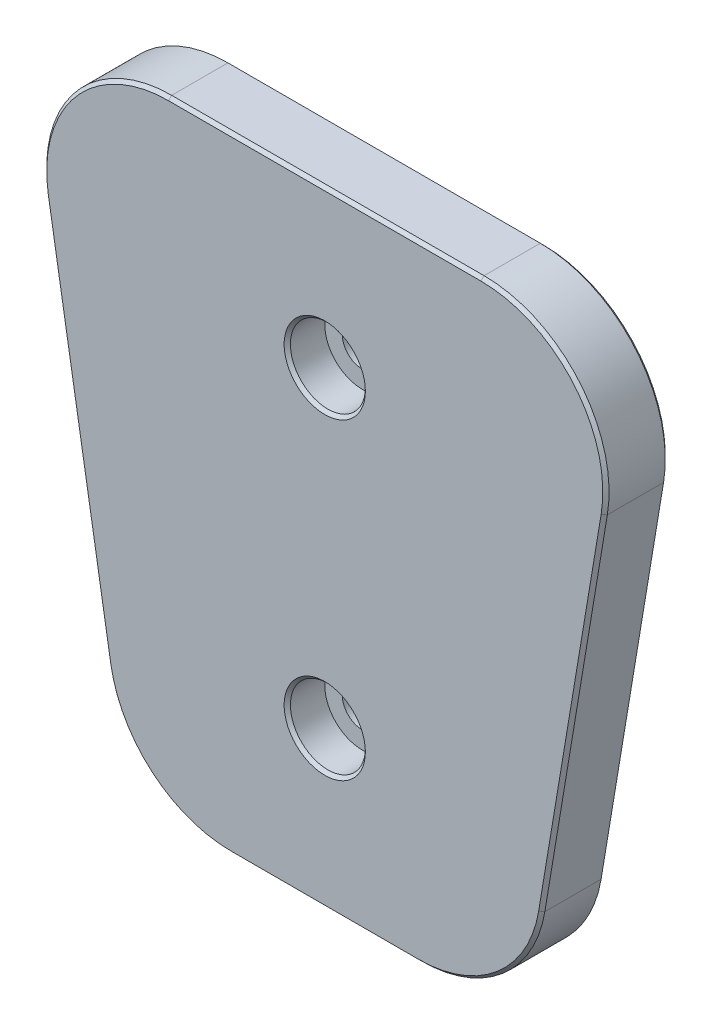
from build123d import *

# Parameters (mm, degrees)
BOSS_EXTRUDE1_DEPTH = 10
SKETCH4_R           = 6
CUT_EXTRUDE1_DEPTH  = 6
SKETCH5_R           = 3.2
CUT_EXTRUDE2_DEPTH  = 131.334145897
CHAMFER1_SIZE       = 0.5


with BuildPart() as part:
    # Sketch3 → Boss-Extrude1 (new body)
    with BuildSketch(Plane.XY):
        with BuildLine():
            Line((-6.355283539, -23.287979746), (3.644716461, -83.287979746))
            ThreePointArc((3.644716461, -83.287979746), (10.445097015, -95.260399649), (23.372594937, -100))
            Line((23.372594937, -100), (53.372594937, -100))
            ThreePointArc((53.372594937, -100), (66.30009286, -95.260399649), (73.100473414, -83.287979746))
            Line((73.100473414, -83.287979746), (83.100473414, -23.287979746))
            ThreePointArc((83.100473414, -23.287979746), (78.632994587, -7.072502077), (63.372594937, 0))
            Line((63.372594937, 0), (13.372594937, 0))
            ThreePointArc((13.372594937, 0), (-1.887804712, -7.072502077), (-6.355283539, -23.287979746))
        make_face()
    extrude(amount=BOSS_EXTRUDE1_DEPTH)

    # Sketch4 → Cut-Extrude1 (cut)
    with BuildSketch(Plane.XY.offset(10)):
        with Locations((38.372594937, -25)):
            Circle(SKETCH4_R)
        with Locations((38.372594937, -75)):
            Circle(SKETCH4_R)
    extrude(amount=-CUT_EXTRUDE1_DEPTH, mode=Mode.SUBTRACT)

    # Sketch5 → Cut-Extrude2 (cut, through all)
    with BuildSketch(Plane.XY.offset(4)):
        with Locations((38.372594937, -25)):
            Circle(SKETCH5_R)
        with Locations((38.372594937, -75)):
            Circle(SKETCH5_R)
    extrude(amount=-CUT_EXTRUDE2_DEPTH, mode=Mode.SUBTRACT)

    # Chamfer1
    chamfer1_edges = [part.edges().sort_by_distance(p)[0] for p in [
        (10.445097015, -95.260399649, 0),
        (38.372594937, -100, 0),
        (66.30009286, -95.260399649, 0),
        (78.100473414, -53.287979746, 0),
        (78.632994587, -7.072502077, 0),
        (38.372594937, 0, 0),
        (-1.887804712, -7.072502077, 0),
        (-1.355283539, -53.287979746, 0),
        (35.172594937, -75, 0),
        (35.172594937, -25, 0),
        (-1.887804712, -7.072502077, 10),
        (38.372594937, 0, 10),
        (78.632994587, -7.072502077, 10),
        (78.100473414, -53.287979746, 10),
        (66.30009286, -95.260399649, 10),
        (38.372594937, -100, 10),
        (10.445097015, -95.260399649, 10),
        (-1.355283539, -53.287979746, 10),
        (32.372594937, -25, 10),
        (32.372594937, -75, 10),
    ]]
    chamfer(chamfer1_edges, length=CHAMFER1_SIZE)


solid = part.part
